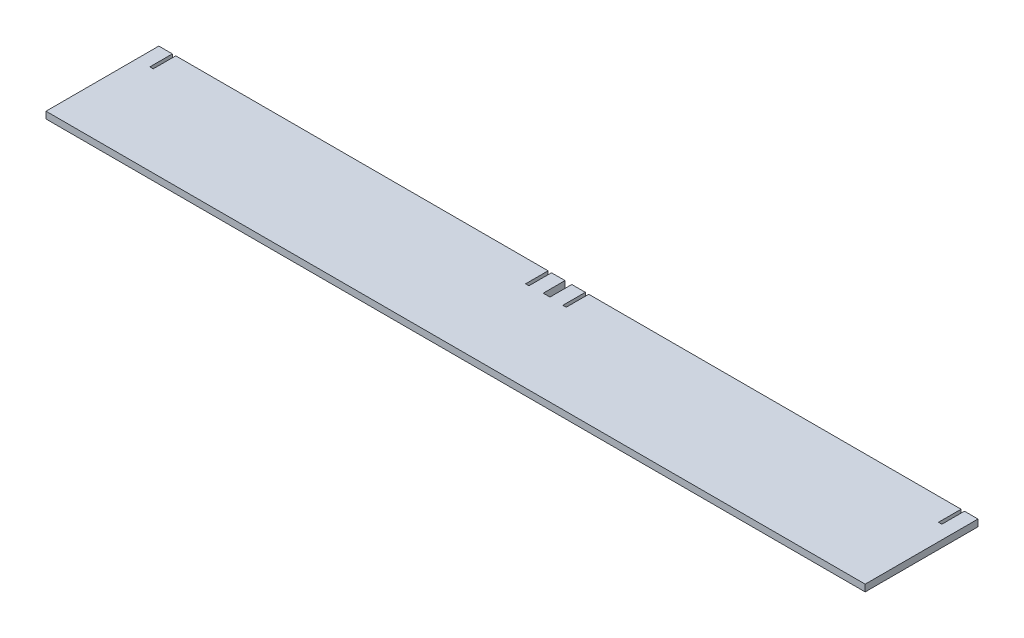
from build123d import *

# Parameters (mm, degrees)
BOSS_EXTRUDE1_DEPTH = 1.5
SKETCH2_W           = 3
SKETCH2_H           = 40.331406252
BOSS_EXTRUDE2_DEPTH = 1.5
LPATTERN2_COUNT     = 2
LPATTERN2_PITCH     = 183


with BuildPart() as part:
    # Sketch1 → Boss-Extrude1 (new, symmetric)
    with BuildSketch(Plane(origin=(0, 0, 0), x_dir=(1, 0, 0), z_dir=(0, 1, 0))):
        Polygon((-84, 25), (-84, 15), (-82.5, 15), (-82.5, 25), (82.5, 25), (82.5, 15), (84, 15), (84, 25), (90, 25), (90, -25), (-90, -25), (-90, 25), align=None)
    boss_extrude1 = extrude(amount=BOSS_EXTRUDE1_DEPTH, both=True)

    # Sketch2 → Boss-Extrude2 (add, symmetric)
    with BuildSketch(Plane(origin=(0, 0, 0), x_dir=(1, 0, 0), z_dir=(0, 1, 0))):
        with Locations((91.5, -4.834296874)):
            Rectangle(SKETCH2_W, SKETCH2_H)
    extrude(amount=BOSS_EXTRUDE2_DEPTH, both=True)

    # LPattern2: Boss-Extrude1 ×2
    with Locations(*[(i * LPATTERN2_PITCH, 0, 0) for i in range(1, LPATTERN2_COUNT)]):
        add(boss_extrude1)


solid = part.part
